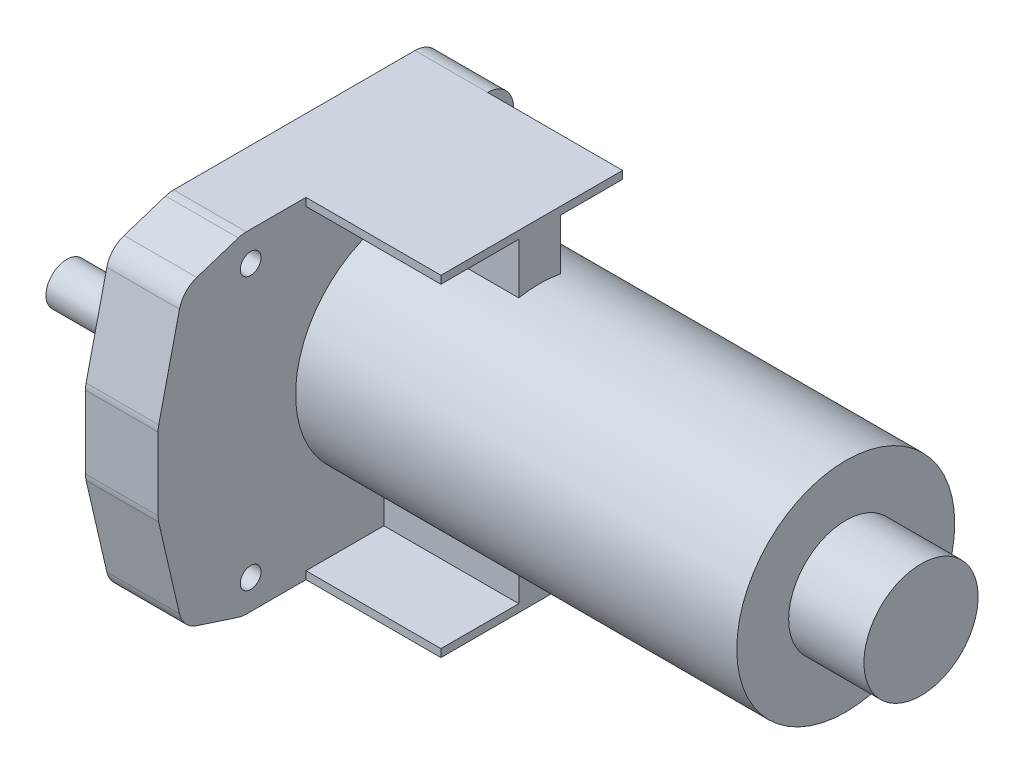
from build123d import *

# Parameters (mm, degrees)
ESQUISSE1_R       = 2
EXTRUSION3_DEPTH  = 14
ESQUISSE3_R       = 21
EXTRUSION4_DEPTH  = 85
ESQUISSE4_R       = 4
EXTRUSION5_DEPTH  = 26.6
ESQUISSE5_R       = 7.25
EXTRUSION6_DEPTH  = 5
EXTRUSION9_DEPTH  = 26
ESQUISSE9_R       = 11
EXTRUSION10_DEPTH = 14.5


with BuildPart() as part:
    # Esquisse1 → Extrusion3 (new body)
    with BuildSketch(Plane(origin=(0, 0, 0), x_dir=(0, 0, -1), z_dir=(1, 0, 0))):
        with BuildLine():
            Line((-6, 31.9), (40.5, 31.9))
            ThreePointArc((40.5, 31.9), (44.035533906, 30.435533906), (45.5, 26.9))
            Line((45.5, 26.9), (45.5, -26.9))
            ThreePointArc((45.5, -26.9), (44.035533906, -30.435533906), (40.5, -31.9))
            Line((40.5, -31.9), (-6, -31.9))
            ThreePointArc((-6, -31.9), (-6.782039696, -31.838462708), (-7.54482955, -31.655365566))
            Line((-7.54482955, -31.655365566), (-15.54482955, -29.056483056))
            ThreePointArc((-15.54482955, -29.056483056), (-17.685916108, -27.679581999), (-18.871597264, -25.426968324))
            Line((-18.871597264, -25.426968324), (-22.871597264, -8.118823709))
            ThreePointArc((-22.871597264, -8.118823709), (-22.967795604, -7.559547531), (-23, -6.992972875))
            Line((-23, -6.992972875), (-23, 6.992972875))
            ThreePointArc((-23, 6.992972875), (-22.967795604, 7.559547531), (-22.871597264, 8.118823709))
            Line((-22.871597264, 8.118823709), (-18.871597264, 25.426968324))
            ThreePointArc((-18.871597264, 25.426968324), (-17.685916108, 27.679581999), (-15.54482955, 29.056483056))
            Line((-15.54482955, 29.056483056), (-7.54482955, 31.655365566))
            ThreePointArc((-7.54482955, 31.655365566), (-6.782039696, 31.838462708), (-6, 31.9))
        make_face()
        with Locations((38.44, -26.2)):
            Circle(ESQUISSE1_R, mode=Mode.SUBTRACT)
        with Locations((-5.16, -26.2)):
            Circle(ESQUISSE1_R, mode=Mode.SUBTRACT)
        with Locations((-5.16, 26.2)):
            Circle(ESQUISSE1_R, mode=Mode.SUBTRACT)
        with Locations((38.44, 26.2)):
            Circle(ESQUISSE1_R, mode=Mode.SUBTRACT)
    extrude(amount=EXTRUSION3_DEPTH)

    # Esquisse3 → Extrusion4 (add)
    with BuildSketch(Plane(origin=(14, 0, 0), x_dir=(0, 0, -1), z_dir=(1, 0, 0))):
        with Locations((24.5, 0)):
            Circle(ESQUISSE3_R)
    extrude(amount=EXTRUSION4_DEPTH)

    # Esquisse4 → Extrusion5 (add)
    with BuildSketch(Plane(origin=(0, 0, 0), x_dir=(0, 0, -1), z_dir=(1, 0, 0))):
        Circle(ESQUISSE4_R)
    extrude(amount=-EXTRUSION5_DEPTH)

    # Esquisse5 → Extrusion6 (add)
    with BuildSketch(Plane(origin=(0, 0, 0), x_dir=(0, 0, -1), z_dir=(1, 0, 0))):
        Circle(ESQUISSE5_R)
    extrude(amount=-EXTRUSION6_DEPTH)

    # Esquisse8 → Extrusion9 (add)
    with BuildSketch(Plane(origin=(14, 0, 0), x_dir=(0, 0, -1), z_dir=(1, 0, 0))):
        Polygon((40.5, 31.9), (5.5, 31.9), (5.5, 30.4), (20.5, 30.4), (20.5, 13.147221685), (28.5, 13.147221685), (28.5, 30.4), (40.5, 30.4), align=None)
        Polygon((40.5, -30.4), (40.5, -31.9), (5.5, -31.9), (5.5, -30.4), (20.5, -30.4), (20.5, -13.147221685), (28.5, -13.147221685), (28.5, -30.4), align=None)
    extrude(amount=EXTRUSION9_DEPTH)

    # Esquisse9 → Extrusion10 (add)
    with BuildSketch(Plane(origin=(99, 0, 0), x_dir=(0, 0, -1), z_dir=(1, 0, 0))):
        with Locations((24.5, 0)):
            Circle(ESQUISSE9_R)
    extrude(amount=EXTRUSION10_DEPTH)


solid = part.part
